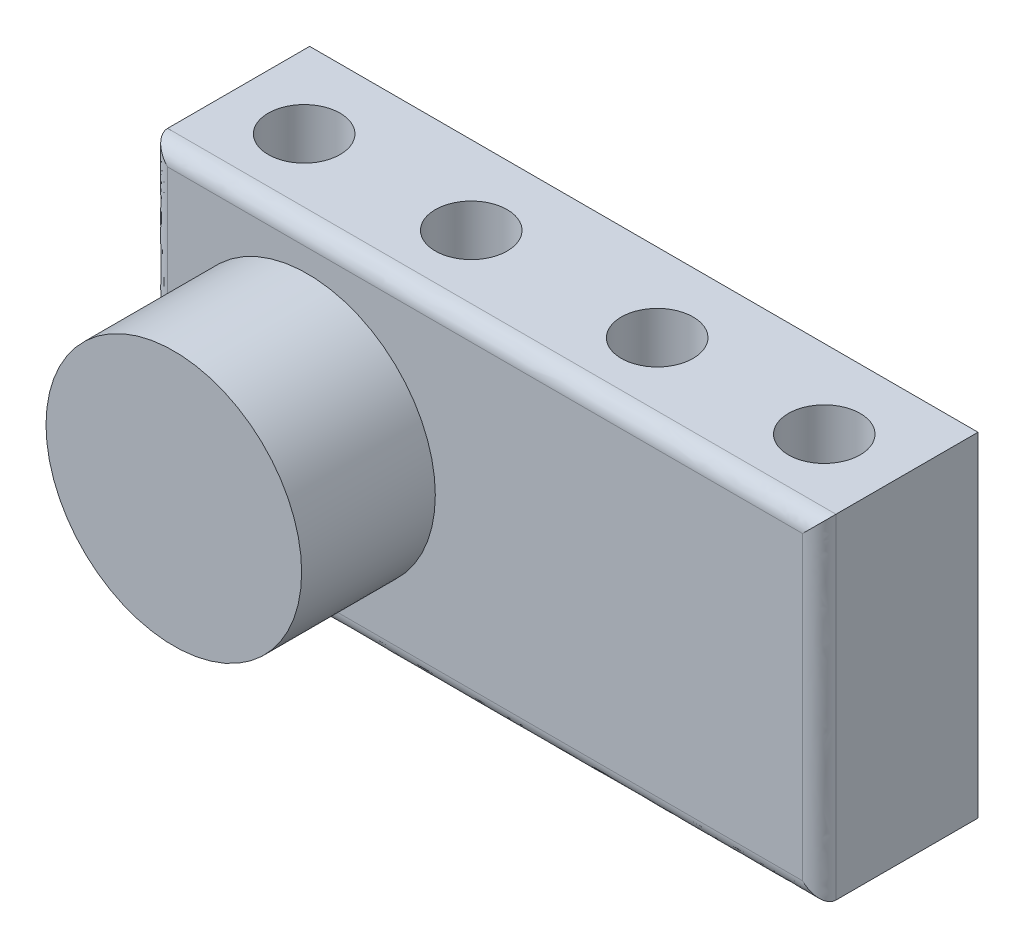
from build123d import *

# Parameters (mm, degrees)
SKETCH1_W           = 40
SKETCH1_H           = 20
BOSS_EXTRUDE1_DEPTH = 9.5
FILLET1_START       = -21
FILLET1_DEPTH       = 41
FILLET1_START_2     = -11
FILLET1_2_DEPTH     = 22
SKETCH4_R           = 7.5
BOSS_EXTRUDE2_DEPTH = 8
SKETCH5_R           = 2.15
CUT_EXTRUDE1_DEPTH  = 34.260336859
SKETCH6_R           = 7.65
BOSS_EXTRUDE3_DEPTH = 8


with BuildPart() as part:
    # Sketch1 → Boss-Extrude1 (new body)
    with BuildSketch(Plane.XY):
        Rectangle(SKETCH1_W, SKETCH1_H)
    extrude(amount=BOSS_EXTRUDE1_DEPTH)

    # Fillet1: read off the stored shape, not the designer's step
    # Fillet1 outline → Fillet1 (cut)
    with BuildSketch(Plane.YZ.offset(FILLET1_START)):
        with BuildLine():
            Line((10, 9.5), (9, 9.5))
            add(Edge.make_bspline(
                [(9, 9.5), (10, 9.5), (10, 8.5)],
                knots=[0, 0, 0, 1, 1, 1], degree=2, weights=[1, 0.707106781, 1]))
            Line((10, 8.5), (10, 9.5))
        make_face()
        with BuildLine():
            add(Edge.make_bspline(
                [(-9, 9.5), (-10, 9.5), (-10, 8.5)],
                knots=[0, 0, 0, 1, 1, 1], degree=2, weights=[1, 0.707106781, 1]))
            Line((-9, 9.5), (-10, 9.5))
            Line((-10, 9.5), (-10, 8.5))
        make_face()
    extrude(amount=FILLET1_DEPTH, mode=Mode.SUBTRACT)

    # Fillet1 2 outline → Fillet1 2 (cut)
    with BuildSketch(Plane(origin=(0, 0, 0), x_dir=(1, 0, 0), z_dir=(0, 1, 0)).offset(FILLET1_START_2)):
        with BuildLine():
            Line((-20, -9.5), (-19, -9.5))
            add(Edge.make_bspline(
                [(-19, -9.5), (-20, -9.5), (-20, -8.5)],
                knots=[0, 0, 0, 1, 1, 1], degree=2, weights=[1, 0.707106781, 1]))
            Line((-20, -8.5), (-20, -9.5))
        make_face()
        with BuildLine():
            add(Edge.make_bspline(
                [(19, -9.5), (20, -9.5), (20, -8.5)],
                knots=[0, 0, 0, 1, 1, 1], degree=2, weights=[1, 0.707106781, 1]))
            Line((19, -9.5), (20, -9.5))
            Line((20, -9.5), (20, -8.5))
        make_face()
    extrude(amount=FILLET1_2_DEPTH, mode=Mode.SUBTRACT)

    # Sketch4 → Boss-Extrude2 (add)
    with BuildSketch(Plane.XY.offset(9.5)):
        with Locations((-10.628602575, 0)):
            Circle(SKETCH4_R)
    extrude(amount=BOSS_EXTRUDE2_DEPTH)

    # Sketch5 → Cut-Extrude1 (cut, through all)
    with BuildSketch(Plane.XZ.offset(10)):
        with Locations(Location((-15.628602575, 4.7, 0), (0, 0, 270))):
            Circle(SKETCH5_R)
        with Locations(Location((-5.628602575, 4.7, 0), (0, 0, 270))):
            Circle(SKETCH5_R)
        with Locations(Location((5.5, 4.7, 0), (0, 0, 270))):
            Circle(SKETCH5_R)
        with Locations(Location((15.5, 4.7, 0), (0, 0, 270))):
            Circle(SKETCH5_R)
    extrude(amount=-CUT_EXTRUDE1_DEPTH, mode=Mode.SUBTRACT)

    # Sketch6 → Boss-Extrude3 (add)
    with BuildSketch(Plane.XY.offset(9.5)):
        with Locations((-10.628602575, 0)):
            Circle(SKETCH6_R)
    extrude(amount=BOSS_EXTRUDE3_DEPTH)


solid = part.part
